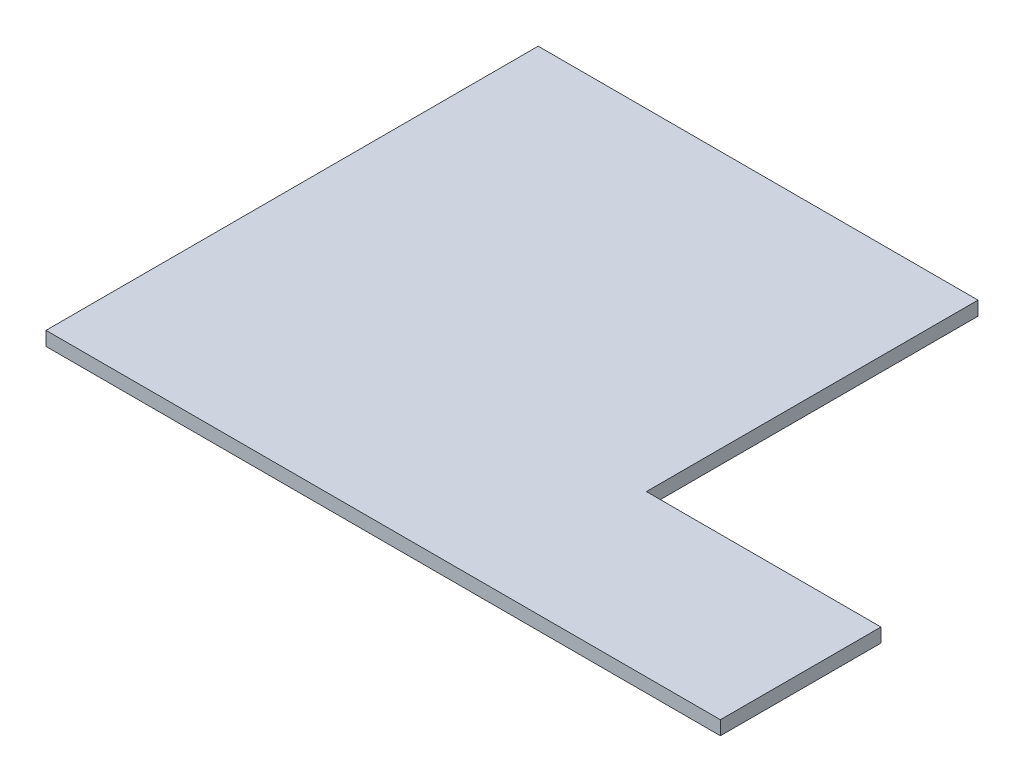
from build123d import *

# Parameters (mm, degrees)
EXTRUDE_1_DEPTH = 20


with BuildPart() as part:
    # 草图1 → 凸台-拉伸1 (new body)
    with BuildSketch(Plane(origin=(0, 0, 0), x_dir=(1, 0, 0), z_dir=(0, 1, 0))):
        Polygon((0, 0), (630, 0), (966, 0), (966, 230), (630, 230), (630, 705), (0, 705), align=None)
    extrude(amount=EXTRUDE_1_DEPTH)


solid = part.part
